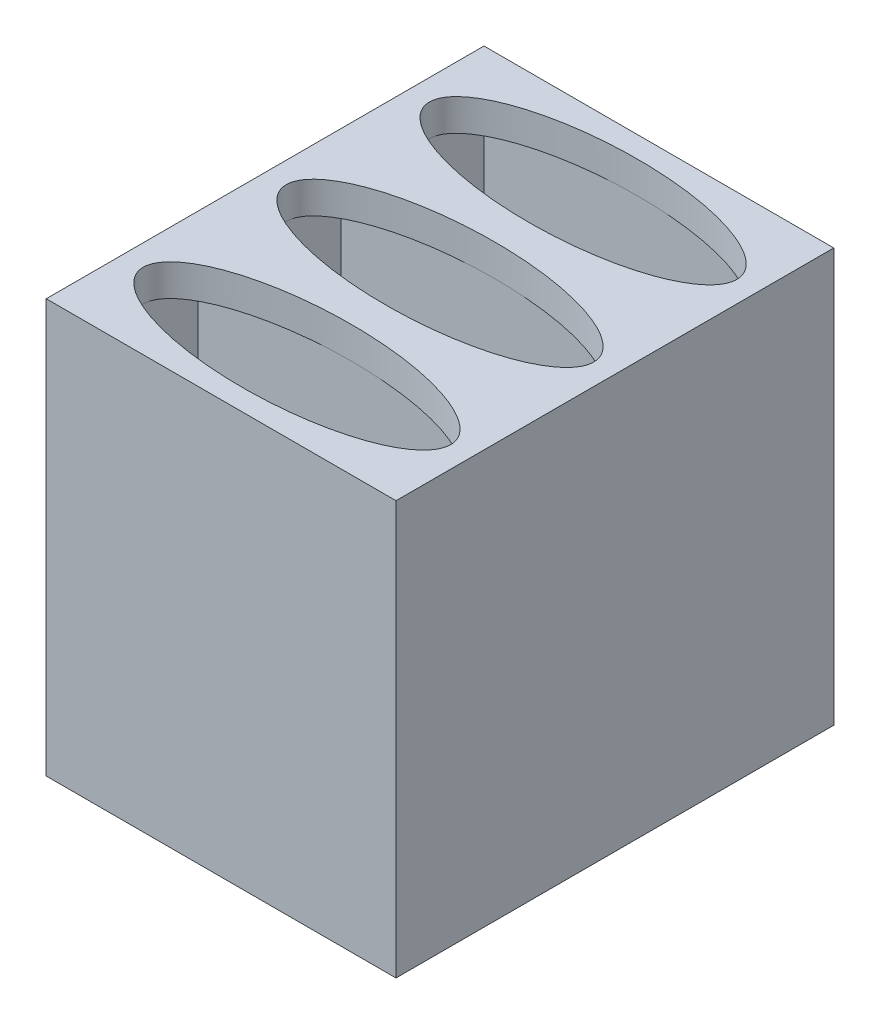
from build123d import *

# Parameters (mm, degrees)
SKETCH_1_W             = 33
SKETCH_1_H             = 14.3
SKETCH_1_W_2           = 29
SKETCH_1_H_2           = 10.3
EXTRUDE_2_DEPTH        = 36
SKETCH_2_W             = 33
SKETCH_2_H             = 14.3
SKETCH_2_RX            = 14.5
SKETCH_2_RY            = 5.15
EXTRUDE_3_DEPTH        = 3
PATTERN_LINEAR_1_COUNT = 3
PATTERN_LINEAR_1_PITCH = 13.5


with BuildPart() as part:
    # 草图1 → 凸台-拉伸2 (new body)
    with BuildSketch(Plane(origin=(0, 0, 0), x_dir=(1, 0, 0), z_dir=(0, 1, 0))):
        Rectangle(SKETCH_1_W, SKETCH_1_H)
        Rectangle(SKETCH_1_W_2, SKETCH_1_H_2, mode=Mode.SUBTRACT)
    extrude_2 = extrude(amount=EXTRUDE_2_DEPTH)

    # 草图2 → 凸台-拉伸3 (add)
    with BuildSketch(Plane(origin=(0, 36, 0), x_dir=(1, 0, 0), z_dir=(0, 1, 0))):
        Rectangle(SKETCH_2_W, SKETCH_2_H)
        with Locations(Location((0, 0), (0, 0, 0))):
            Ellipse(SKETCH_2_RX, SKETCH_2_RY, mode=Mode.SUBTRACT)
    extrude_3 = extrude(amount=EXTRUDE_3_DEPTH)

    # 阵列(线性)1: 凸台-拉伸2, 凸台-拉伸3 ×3
    with Locations(*[(0, 0, i * PATTERN_LINEAR_1_PITCH) for i in range(1, PATTERN_LINEAR_1_COUNT)]):
        add(extrude_2)
        add(extrude_3)


solid = part.part
